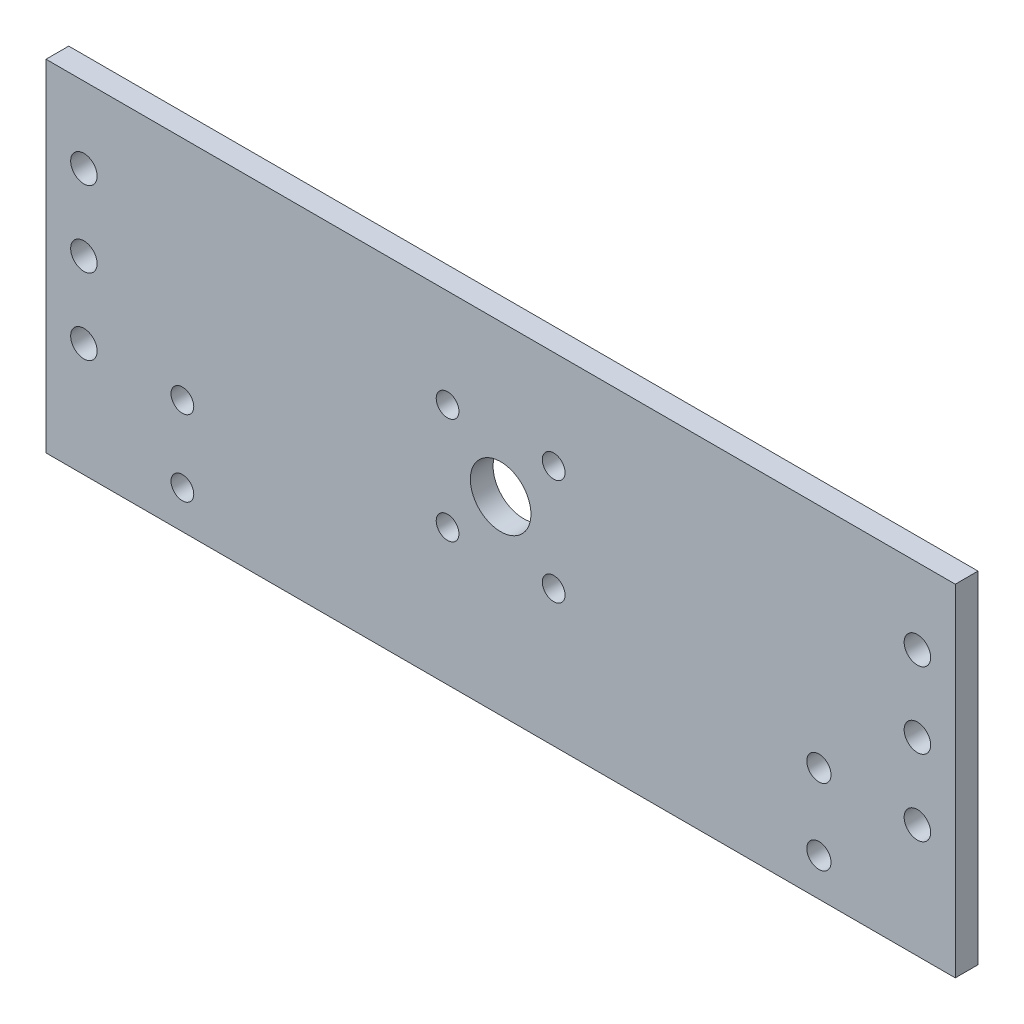
from build123d import *

# Parameters (mm, degrees)
ESQUISSE1_W             = 120
ESQUISSE1_H             = 45
BOSS_EXTRU_1_DEPTH      = 3
ESQUISSE2_R             = 1.747592995
ESQUISSE2_R_2           = 4
ESQUISSE2_R_3           = 1.5
ESQUISSE2_R_4           = 1.6
ENL_V_MAT_EXTRU_1_DEPTH = 10


with BuildPart() as part:
    # Esquisse1 → Boss.-Extru.1 (new body)
    with BuildSketch(Plane.XY):
        Rectangle(ESQUISSE1_W, ESQUISSE1_H)
    extrude(amount=BOSS_EXTRU_1_DEPTH)

    # Esquisse2 → Enlèv. mat.-Extru.1 (cut)
    with BuildSketch(Plane.XY.offset(3)):
        with Locations((-55, 12.5)):
            Circle(ESQUISSE2_R)
        with Locations((55, 12.5)):
            Circle(ESQUISSE2_R)
        with Locations((-55, 2.5)):
            Circle(ESQUISSE2_R)
        with Locations((-55, -7.5)):
            Circle(ESQUISSE2_R)
        with Locations((55, -7.5)):
            Circle(ESQUISSE2_R)
        with Locations((55, 2.5)):
            Circle(ESQUISSE2_R)
        with Locations((0, 2.5)):
            Circle(ESQUISSE2_R_2)
        with Locations((-7, 9.5)):
            Circle(ESQUISSE2_R_3)
        with Locations((7, 9.5)):
            Circle(ESQUISSE2_R_3)
        with Locations((7, -4.5)):
            Circle(ESQUISSE2_R_3)
        with Locations((-7, -4.5)):
            Circle(ESQUISSE2_R_3)
        with Locations((42, -7.5)):
            Circle(ESQUISSE2_R_4)
        with Locations((42, -17.5)):
            Circle(ESQUISSE2_R_4)
        with Locations((-42, -17.465891095)):
            Circle(ESQUISSE2_R_3)
        with Locations((-42, -7.465891095)):
            Circle(ESQUISSE2_R_3)
    extrude(amount=-ENL_V_MAT_EXTRU_1_DEPTH, mode=Mode.SUBTRACT)


solid = part.part
